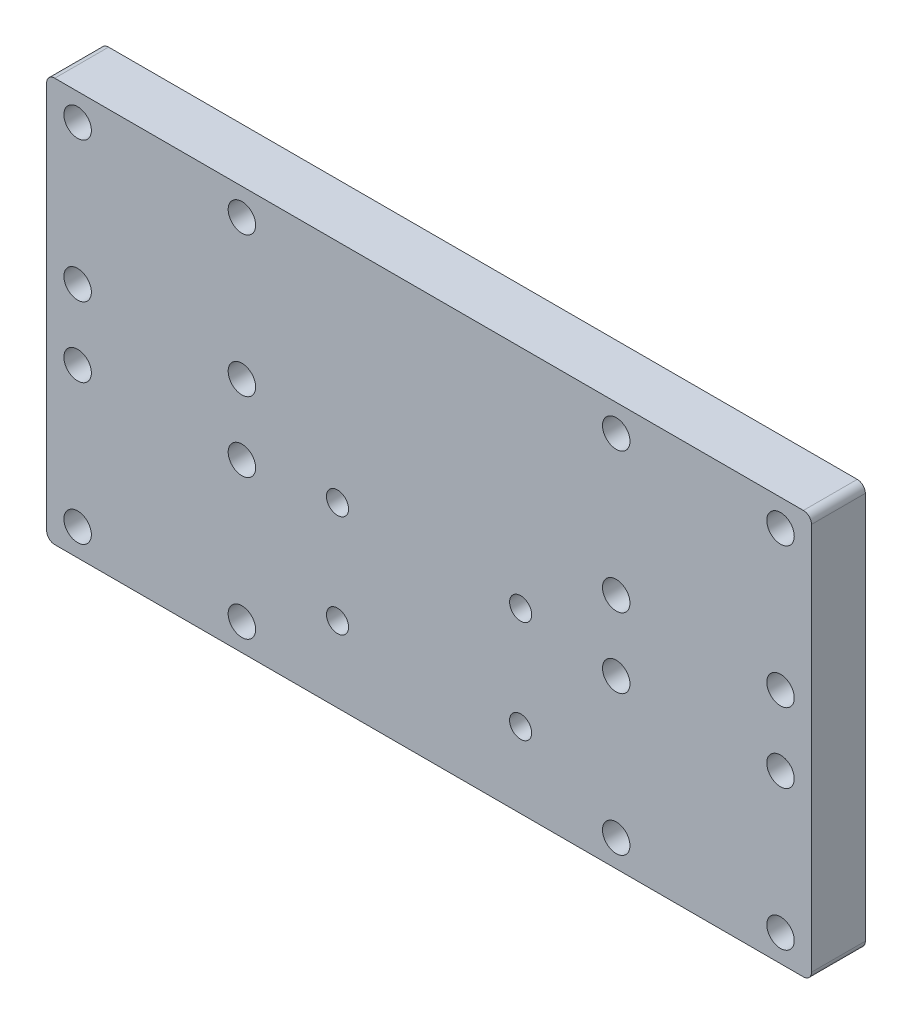
from build123d import *

# Parameters (mm, degrees)
SKETCH1_W           = 142
SKETCH1_H           = 75
BOSS_EXTRUDE1_DEPTH = 5
SKETCH2_R           = 2.55
CUT_EXTRUDE1_DEPTH  = 81.915078941
SKETCH3_R           = 2.05
CUT_EXTRUDE2_DEPTH  = 81.915078941
FILLET1_R           = 1.5


with BuildPart() as part:
    # Sketch1 → Boss-Extrude1 (new, symmetric)
    with BuildSketch(Plane.XY):
        Rectangle(SKETCH1_W, SKETCH1_H)
    extrude(amount=BOSS_EXTRUDE1_DEPTH, both=True)

    # Sketch2 → Cut-Extrude1 (cut, through all)
    with BuildSketch(Plane.XY.offset(5)):
        with Locations((-65.25, 32.5)):
            Circle(SKETCH2_R)
        with Locations((-34.75, 32.5)):
            Circle(SKETCH2_R)
        with Locations((-34.75, 6.5)):
            Circle(SKETCH2_R)
        with Locations((-65.25, 6.5)):
            Circle(SKETCH2_R)
        with Locations((65.25, 32.5)):
            Circle(SKETCH2_R)
        with Locations((65.25, 6.5)):
            Circle(SKETCH2_R)
        with Locations((34.75, 6.5)):
            Circle(SKETCH2_R)
        with Locations((34.75, 32.5)):
            Circle(SKETCH2_R)
        with Locations((-65.25, -6.5)):
            Circle(SKETCH2_R)
        with Locations((-34.75, -6.5)):
            Circle(SKETCH2_R)
        with Locations((-34.75, -32.5)):
            Circle(SKETCH2_R)
        with Locations((-65.25, -32.5)):
            Circle(SKETCH2_R)
        with Locations((34.75, -6.5)):
            Circle(SKETCH2_R)
        with Locations((65.25, -6.5)):
            Circle(SKETCH2_R)
        with Locations((65.25, -32.5)):
            Circle(SKETCH2_R)
        with Locations((34.75, -32.5)):
            Circle(SKETCH2_R)
    extrude(amount=-CUT_EXTRUDE1_DEPTH, mode=Mode.SUBTRACT)

    # Sketch3 → Cut-Extrude2 (cut, through all)
    with BuildSketch(Plane.XY.offset(5)):
        with Locations((-17, -4.5)):
            Circle(SKETCH3_R)
        with Locations((-17, -23.5)):
            Circle(SKETCH3_R)
        with Locations((17, -23.5)):
            Circle(SKETCH3_R)
        with Locations((17, -4.5)):
            Circle(SKETCH3_R)
    extrude(amount=-CUT_EXTRUDE2_DEPTH, mode=Mode.SUBTRACT)

    # Fillet1
    fillet1_edges = [part.edges().sort_by_distance(p)[0] for p in [
        (-71, -37.5, 0),
        (71, -37.5, 0),
        (71, 37.5, 0),
        (-71, 37.5, 0),
    ]]
    fillet(fillet1_edges, radius=FILLET1_R)


solid = part.part
